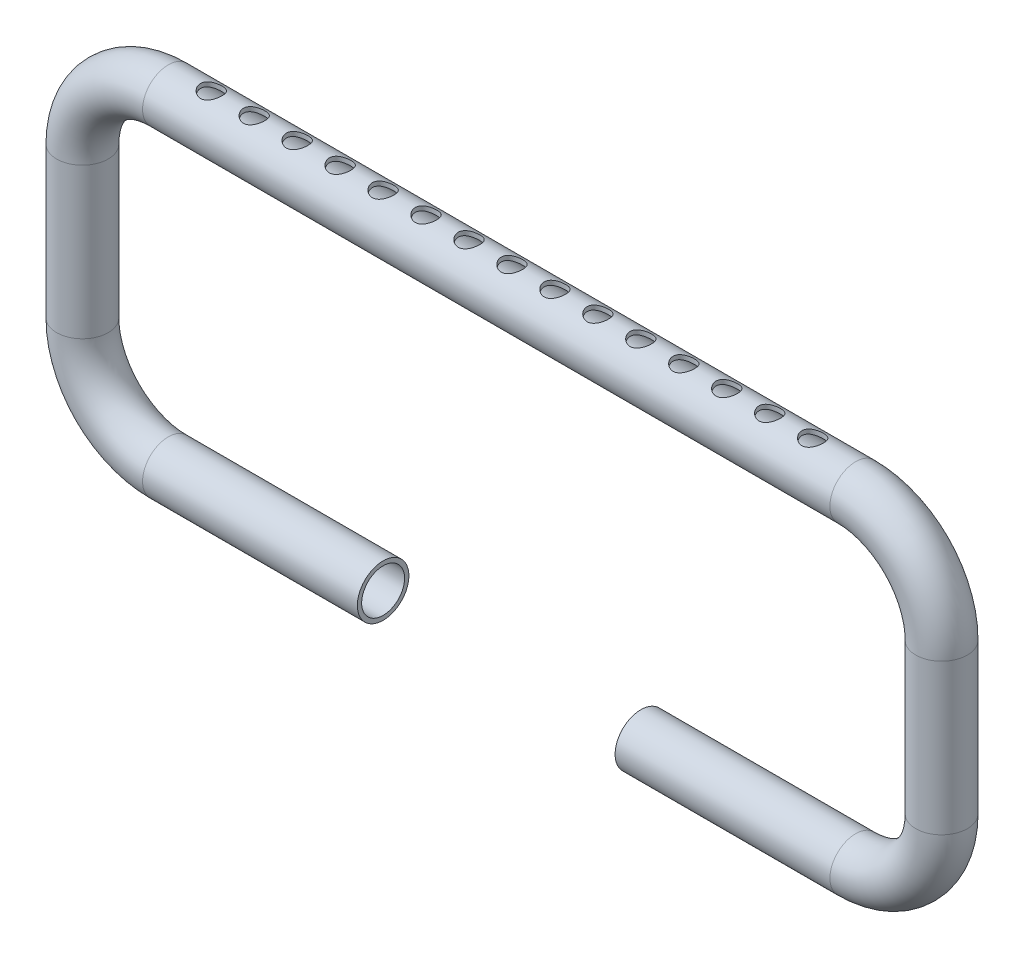
from build123d import *

# Parameters (mm, degrees)
SKETCH1_R          = 6
SKETCH1_R_2        = 5
SKETCH3_R          = 2.5
CUT_EXTRUDE1_DEPTH = 15


with BuildPart() as part:
    # Sweep1: sweep along a path in Sketch2
    with BuildLine(Plane.XY) as sweep1_path:
        Line((0, 0), (-50, 0))
        ThreePointArc((-50, 0), (-64.142135624, 5.857864376), (-70, 20))
        Line((-70, 20), (-70, 55))
        ThreePointArc((-70, 55), (-64.142135624, 69.142135624), (-50, 75))
        Line((-50, 75), (110, 75))
        ThreePointArc((110, 75), (124.142135624, 69.142135624), (130, 55))
        Line((130, 55), (130, 20))
        ThreePointArc((130, 20), (124.142135624, 5.857864376), (110, 0))
        Line((110, 0), (60, 0))
    # Sketch1 → Sweep1 (sweep)
    with BuildSketch(Plane(origin=(0, 0, 0), x_dir=(0, 0, -1), z_dir=(1, 0, 0))):
        Circle(SKETCH1_R)
        Circle(SKETCH1_R_2, mode=Mode.SUBTRACT)
    sweep(path=sweep1_path.line)

    # Sketch3 → Cut-Extrude1 (cut)
    with BuildSketch(Plane(origin=(0, 81, 0), x_dir=(1, 0, 0), z_dir=(0, 1, 0))):
        with Locations((100, 0)):
            Circle(SKETCH3_R)
        with Locations((90, 0)):
            Circle(SKETCH3_R)
        with Locations((80, 0)):
            Circle(SKETCH3_R)
        with Locations((70, 0)):
            Circle(SKETCH3_R)
        with Locations((60, 0)):
            Circle(SKETCH3_R)
        with Locations((50, 0)):
            Circle(SKETCH3_R)
        with Locations((40, 0)):
            Circle(SKETCH3_R)
        with Locations((30, 0)):
            Circle(SKETCH3_R)
        with Locations((20, 0)):
            Circle(SKETCH3_R)
        with Locations((10, 0)):
            Circle(SKETCH3_R)
        Circle(SKETCH3_R)
        with Locations((-10, 0)):
            Circle(SKETCH3_R)
        with Locations((-20, 0)):
            Circle(SKETCH3_R)
        with Locations((-30, 0)):
            Circle(SKETCH3_R)
        with Locations((-40, 0)):
            Circle(SKETCH3_R)
    extrude(amount=-CUT_EXTRUDE1_DEPTH, mode=Mode.SUBTRACT)


solid = part.part
